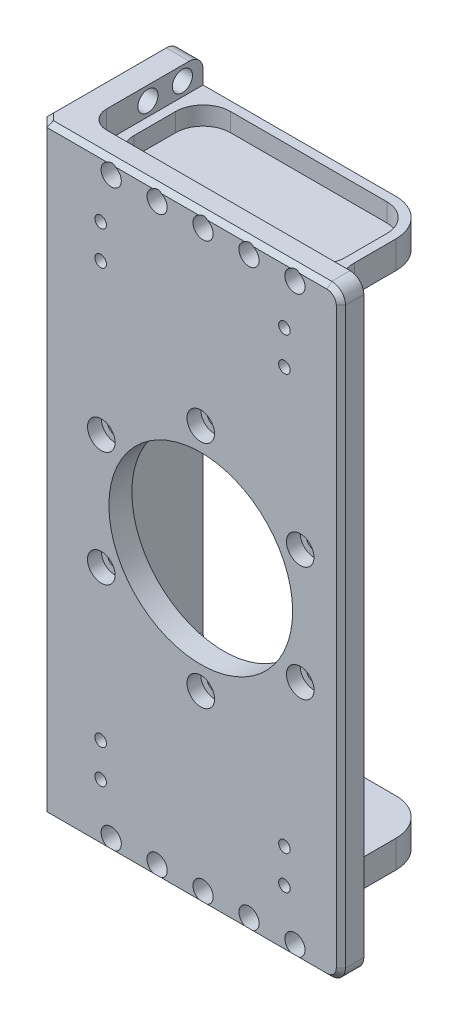
from build123d import *

# Parameters (mm, degrees)
SKETCH_1_W                  = 60
SKETCH_1_H                  = 131
EXTRUDE_1_DEPTH             = 5
SKETCH_2_W                  = 30
SKETCH_2_H                  = 131
EXTRUDE_2_DEPTH             = 6
SKETCH_3_R                  = 20
CUT_EXTRUDE_1_DEPTH         = 10
CHAMFER_1_SIZE              = 2
FILLET_1_R                  = 3
SKETCH_13_R                 = 1.6
CUT_EXTRUDE_2_DEPTH         = 6
SKETCH_14_R                 = 3
CUT_EXTRUDE_3_DEPTH         = 3
CHAMFER_4_SIZE              = 1
SKETCH_16_W                 = 50
SKETCH_16_H                 = 6
EXTRUDE_4_DEPTH             = 25
FILLET_3_R                  = 4
FILLET_4_R                  = 10
FILLET_5_R                  = 8
CUT_EXTRUDE_4_DEPTH         = 4
FILLET_6_R                  = 6
SKETCH_19_R                 = 2.2
CUT_EXTRUDE_5_DEPTH         = 18
SKETCH_20_R                 = 2.2
CUT_EXTRUDE_6_DEPTH         = 18
HOLE_WIZARD_M3_1_AT_2_COUNT = 2
HOLE_WIZARD_M3_1_AT_2_PITCH = 40
HOLE_WIZARD_M3_1_AT_3_COUNT = 2
HOLE_WIZARD_M3_1_AT_3_PITCH = 105.617529322
HOLE_WIZARD_M3_1_AT_4_COUNT = 2
HOLE_WIZARD_M3_1_AT_4_PITCH = 97.75
HOLE_WIZARD_M3_2_D          = 2.5
HOLE_WIZARD_M3_2_DEPTH      = 7.5
HOLE_WIZARD_M3_2_TIP        = 0.751075774


with BuildPart() as part:
    # 草图1 → 凸台-拉伸1 (new body)
    with BuildSketch(Plane.XY):
        with Locations((-207.175860782, 60.5)):
            Rectangle(SKETCH_1_W, SKETCH_1_H)
    extrude(amount=EXTRUDE_1_DEPTH)

    # 草图2 → 凸台-拉伸2 (add)
    with BuildSketch(Plane.ZY.offset(237.175860782)):
        with Locations((-10, 60.5)):
            Rectangle(SKETCH_2_W, SKETCH_2_H)
    extrude(amount=EXTRUDE_2_DEPTH)

    # 草图3 → 切除-拉伸1 (cut)
    with BuildSketch(Plane.XY.offset(5)):
        with Locations((-207.675860782, 60.5)):
            Circle(SKETCH_3_R)
    extrude(amount=-CUT_EXTRUDE_1_DEPTH, mode=Mode.SUBTRACT)

    # 倒角1
    chamfer_1_edges = [part.edges().sort_by_distance(p)[0] for p in [
        (-243.175860782, 60.5, 5),
    ]]
    chamfer(chamfer_1_edges, length=CHAMFER_1_SIZE)

    # 圆角1
    fillet_1_edges = [part.edges().sort_by_distance(p)[0] for p in [
        (-240.175860782, 126, -25),
        (-240.175860782, -5, -25),
        (-177.175860782, 126, 2.5),
        (-177.175860782, -5, 2.5),
    ]]
    fillet(fillet_1_edges, radius=FILLET_1_R)

    # 草图13 → 切除-拉伸2 (cut)
    with BuildSketch(Plane.XY.offset(5)):
        with Locations((-207.675860782, 85.5)):
            Circle(SKETCH_13_R)
        with Locations((-229.326495877, 73)):
            Circle(SKETCH_13_R)
        with Locations((-186.025225688, 73)):
            Circle(SKETCH_13_R)
        with Locations((-186.025225688, 48)):
            Circle(SKETCH_13_R)
        with Locations((-207.675860782, 35.5)):
            Circle(SKETCH_13_R)
        with Locations((-229.326495877, 48)):
            Circle(SKETCH_13_R)
    extrude(amount=-CUT_EXTRUDE_2_DEPTH, mode=Mode.SUBTRACT)

    # 草图14 → 切除-拉伸3 (cut)
    with BuildSketch(Plane.XY.offset(5)):
        with Locations((-207.675860782, 85.5)):
            Circle(SKETCH_14_R)
        with Locations((-186.025225688, 73)):
            Circle(SKETCH_14_R)
        with Locations((-186.025225688, 48)):
            Circle(SKETCH_14_R)
        with Locations((-207.675860782, 35.5)):
            Circle(SKETCH_14_R)
        with Locations((-229.326495877, 48)):
            Circle(SKETCH_14_R)
        with Locations((-229.326495877, 73)):
            Circle(SKETCH_14_R)
    extrude(amount=-CUT_EXTRUDE_3_DEPTH, mode=Mode.SUBTRACT)

    # 倒角4
    chamfer_4_edges = [part.edges().sort_by_distance(p)[0] for p in [
        (-243.175860782, 126, -9.5),
        (-242.175860782, 126, 4),
        (-210.675860782, -5, 5),
        (-242.175860782, -5, 4),
        (-243.175860782, 60.5, -25),
        (-210.675860782, 126, 5),
        (-243.175860782, -5, -9.5),
        (-243.175860782, -4.121320344, -24.121320344),
        (-243.175860782, 125.121320344, -24.121320344),
        (-177.175860782, 60.5, 5),
        (-178.054540439, -4.121320344, 5),
        (-178.054540439, 125.121320344, 5),
    ]]
    chamfer(chamfer_4_edges, length=CHAMFER_4_SIZE)

    # 草图16 → 凸台-拉伸4 (add)
    with BuildSketch(Plane(origin=(0, 0, 0), x_dir=(-1, 0, 0), z_dir=(0, 0, -1))):
        with Locations((212.175860782, 117)):
            Rectangle(SKETCH_16_W, SKETCH_16_H)
    extrude_4 = extrude(amount=EXTRUDE_4_DEPTH)

    # 镜向1: 凸台-拉伸4 across plane
    add(extrude_4.mirror(Plane(origin=(0, 60.5, 0), x_dir=(0, 0, 1), z_dir=(0, -1, 0))))

    # 圆角3
    fillet_3_edges = [part.edges().sort_by_distance(p)[0] for p in [
        (-237.175860782, -2, 0),
        (-237.175860782, 123, 0),
    ]]
    fillet(fillet_3_edges, radius=FILLET_3_R)

    # 圆角4
    fillet_4_edges = [part.edges().sort_by_distance(p)[0] for p in [
        (-237.175860782, 114, -12.5),
        (-237.175860782, 7, -12.5),
    ]]
    fillet(fillet_4_edges, radius=FILLET_4_R)

    # 圆角5
    fillet_5_edges = [part.edges().sort_by_distance(p)[0] for p in [
        (-187.175860782, 117, -25),
        (-187.175860782, 117, 0),
        (-187.175860782, 4, 0),
        (-187.175860782, 4, -25),
    ]]
    fillet(fillet_5_edges, radius=FILLET_5_R)

    # 草图17 → 切除-拉伸4 (cut)
    with BuildSketch(Plane(origin=(0, 120, 0), x_dir=(1, 0, 0), z_dir=(0, 1, 0))):
        with BuildLine():
            Line((-235.175860782, 4), (-235.175860782, 2))
            Line((-235.175860782, 2), (-233.175860782, 2))
            Line((-233.175860782, 2), (-187.175860782, 2))
            ThreePointArc((-187.175860782, 2), (-188.662693763, 4.83772234), (-189.175860782, 8))
            Line((-189.175860782, 8), (-189.175860782, 17))
            ThreePointArc((-189.175860782, 17), (-190.933220095, 21.242640687), (-195.175860782, 23))
            Line((-195.175860782, 23), (-235.175860782, 23))
            Line((-235.175860782, 23), (-235.175860782, 4))
        make_face()
    cut_extrude_4 = extrude(amount=-CUT_EXTRUDE_4_DEPTH, mode=Mode.SUBTRACT)

    # 镜向2: 切除-拉伸4 across plane
    add(cut_extrude_4.mirror(Plane(origin=(0, 60.5, 0), x_dir=(0, 0, 1), z_dir=(0, -1, 0))), mode=Mode.SUBTRACT)

    # 圆角6
    fillet_6_edges = [part.edges().sort_by_distance(p)[0] for p in [
        (-235.175860782, 118, -2),
        (-235.175860782, 118, -23),
        (-235.175860782, 3, -2),
        (-235.175860782, 3, -23),
        (-187.175860782, 118, -2),
        (-187.175860782, 3, -2),
    ]]
    fillet(fillet_6_edges, radius=FILLET_6_R - 0.0001)  # a hair under: the kernel refuses the full size

    # 草图19 → 切除-拉伸5 (cut)
    with BuildSketch(Plane.XY.offset(5)):
        with Locations((-217.175860782, -2)):
            Circle(SKETCH_19_R)
        with Locations((-187.175860782, -2)):
            Circle(SKETCH_19_R)
        with Locations((-197.175860782, -2)):
            Circle(SKETCH_19_R)
        with Locations((-207.175860782, -2)):
            Circle(SKETCH_19_R)
        with Locations((-227.175860782, -2)):
            Circle(SKETCH_19_R)
    cut_extrude_5 = extrude(amount=-CUT_EXTRUDE_5_DEPTH, mode=Mode.SUBTRACT)

    # 镜向3: 切除-拉伸5 across plane
    add(cut_extrude_5.mirror(Plane(origin=(0, 60.5, 0), x_dir=(0, 0, 1), z_dir=(0, -1, 0))), mode=Mode.SUBTRACT)

    # 草图20 → 切除-拉伸6 (cut)
    with BuildSketch(Plane.ZY.offset(243.175860782)):
        with Locations((-20.5, -2)):
            Circle(SKETCH_20_R)
        with Locations((-13, -2)):
            Circle(SKETCH_20_R)
    cut_extrude_6 = extrude(amount=-CUT_EXTRUDE_6_DEPTH, mode=Mode.SUBTRACT)

    # 镜向4: 切除-拉伸6 across plane
    add(cut_extrude_6.mirror(Plane(origin=(0, 60.5, 0), x_dir=(0, 0, 1), z_dir=(0, -1, 0))), mode=Mode.SUBTRACT)

    # 草图23 → M3 螺纹孔1 (revolve, cut)
    with BuildSketch(Plane(origin=(-229.465860782, 113.065, 5), x_dir=(0, -1, 0), z_dir=(1, 0, 0))):
        Polygon((0, 0), (0, 8.251075774), (1.25, 7.5), (1.25, 0), align=None)
    hole_wizard_m3_1 = revolve(axis=Axis((-229.465860782, 113.065, 11.35), (0, 0, -1)), mode=Mode.SUBTRACT)

    # M3 螺纹孔1 at 2: M3 螺纹孔1 ×2
    with Locations(*[(i * HOLE_WIZARD_M3_1_AT_2_PITCH, 0, 0) for i in range(1, HOLE_WIZARD_M3_1_AT_2_COUNT)]):
        add(hole_wizard_m3_1, mode=Mode.SUBTRACT)

    # M3 螺纹孔1 at 3: M3 螺纹孔1 ×2
    with Locations(*[Vector(0.3787250114344214, -0.9255092466928666, 0) * (i * HOLE_WIZARD_M3_1_AT_3_PITCH) for i in range(1, HOLE_WIZARD_M3_1_AT_3_COUNT)]):
        add(hole_wizard_m3_1, mode=Mode.SUBTRACT)

    # M3 螺纹孔1 at 4: M3 螺纹孔1 ×2
    with Locations(*[(0, -i * HOLE_WIZARD_M3_1_AT_4_PITCH, 0) for i in range(1, HOLE_WIZARD_M3_1_AT_4_COUNT)]):
        add(hole_wizard_m3_1, mode=Mode.SUBTRACT)

    # 镜向5: M3 螺纹孔1 across plane
    add(hole_wizard_m3_1.mirror(Plane(origin=(0, 60.5, 0), x_dir=(0, 0, 1), z_dir=(0, -1, 0))), mode=Mode.SUBTRACT)

    # 镜向5 copy 1 sketch → 镜向5 copy 1 (revolve, cut)
    with BuildSketch(Plane(origin=(-189.465860782, 7.935, 5), x_dir=(0, 1, 0), z_dir=(1, 0, 0))):
        Polygon((0, 0), (0, -8.251075774), (1.25, -7.5), (1.25, 0), align=None)
    revolve(axis=Axis((-189.465860782, 7.935, 11.35), (0, 0, 1)), mode=Mode.SUBTRACT)

    # 镜向5 copy 2 sketch → 镜向5 copy 2 (revolve, cut)
    with BuildSketch(Plane(origin=(-189.465860782, 105.685, 5), x_dir=(0, 1, 0), z_dir=(1, 0, 0))):
        Polygon((0, 0), (0, -8.251075774), (1.25, -7.5), (1.25, 0), align=None)
    revolve(axis=Axis((-189.465860782, 105.685, 11.35), (0, 0, 1)), mode=Mode.SUBTRACT)

    # 镜向5 copy 3 sketch → 镜向5 copy 3 (revolve, cut)
    with BuildSketch(Plane(origin=(-229.465860782, 105.685, 5), x_dir=(0, 1, 0), z_dir=(1, 0, 0))):
        Polygon((0, 0), (0, -8.251075774), (1.25, -7.5), (1.25, 0), align=None)
    revolve(axis=Axis((-229.465860782, 105.685, 11.35), (0, 0, 1)), mode=Mode.SUBTRACT)

    # M3 螺纹孔2
    with Locations(Plane.ZY.offset(243.175860782)):
        with Locations((-7.12, 85.8), (-7.12, 35.2)):
            Hole(HOLE_WIZARD_M3_2_D / 2, depth=HOLE_WIZARD_M3_2_DEPTH)
            with Locations((0, 0, -(HOLE_WIZARD_M3_2_DEPTH + HOLE_WIZARD_M3_2_TIP / 2))):  # 118° drill point
                Cone(0, HOLE_WIZARD_M3_2_D / 2, HOLE_WIZARD_M3_2_TIP, mode=Mode.SUBTRACT)


solid = part.part
